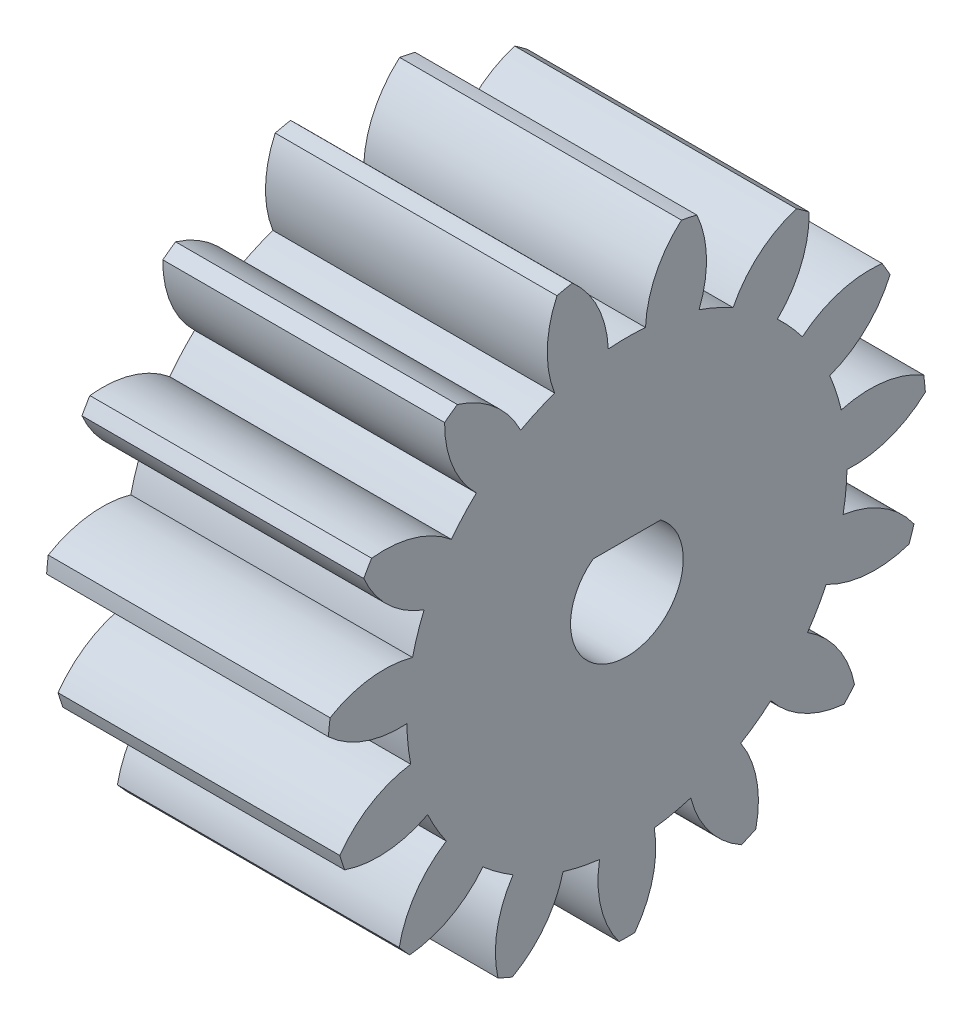
from build123d import *

# Parameters (mm, degrees)
BASPROSKE_W         = 10
BASPROSKE_H         = 10.625
TOOTHCUT_DEPTH      = 19.049411348
TEETHCUTS_COUNT     = 15
TEETHCUTS_ANGLE     = 336
BORSKE_R            = 2
BORE_DEPTH          = 50.0000508
BOSS_EXTRUDE1_DEPTH = 10


with BuildPart() as part:
    # BasProSke → Base-Revolve (revolve)
    with BuildSketch(Plane(origin=(0, 0, 0), x_dir=(1, 0, 0), z_dir=(0, 1, 0))):
        with Locations((5, 5.3125)):
            Rectangle(BASPROSKE_W, BASPROSKE_H)
    revolve(axis=Axis((-10, 0, 0), (1, 0, 0)))

    # TooCutSke → ToothCut (cut, through all)
    with BuildSketch(Plane(origin=(0, 0, 0), x_dir=(0, 0, -1), z_dir=(1, 0, 0))):
        with BuildLine():
            ThreePointArc((0.660831632, 7.78349753), (0, 7.8115), (-0.660831632, 7.78349753))
            ThreePointArc((-0.660831632, 7.78349753), (-1.031814994, 9.260718016), (-1.959681305, 10.46855622))
            ThreePointArc((-1.959681305, 10.46855622), (0, 10.6504), (1.959681305, 10.46855622))
            ThreePointArc((1.959681305, 10.46855622), (1.031814994, 9.260718016), (0.660831632, 7.78349753))
        make_face()
    toothcut = extrude(amount=TOOTHCUT_DEPTH, mode=Mode.SUBTRACT)

    # TeethCuts: ToothCut ×15 about axis
    teethcuts_axis = Axis((-10, 0, 0), (1, 0, 0))
    for i in range(1, TEETHCUTS_COUNT):
        add(toothcut.rotate(teethcuts_axis, i * TEETHCUTS_ANGLE / (TEETHCUTS_COUNT - 1)), mode=Mode.SUBTRACT)

    # BorSke → Bore (cut, symmetric)
    with BuildSketch(Plane(origin=(0, 0, 0), x_dir=(0, 0, -1), z_dir=(1, 0, 0))):
        Circle(BORSKE_R)
    extrude(amount=BORE_DEPTH, both=True, mode=Mode.SUBTRACT)

    # Sketch2 → Boss-Extrude1 (add)
    with BuildSketch(Plane(origin=(10, 0, 0), x_dir=(0, 0, -1), z_dir=(1, 0, 0))):
        with BuildLine():
            ThreePointArc((1.2, 1.6), (0, 2), (-1.2, 1.6))
            Line((-1.2, 1.6), (1.2, 1.6))
        make_face()
    extrude(amount=-BOSS_EXTRUDE1_DEPTH)


solid = part.part
